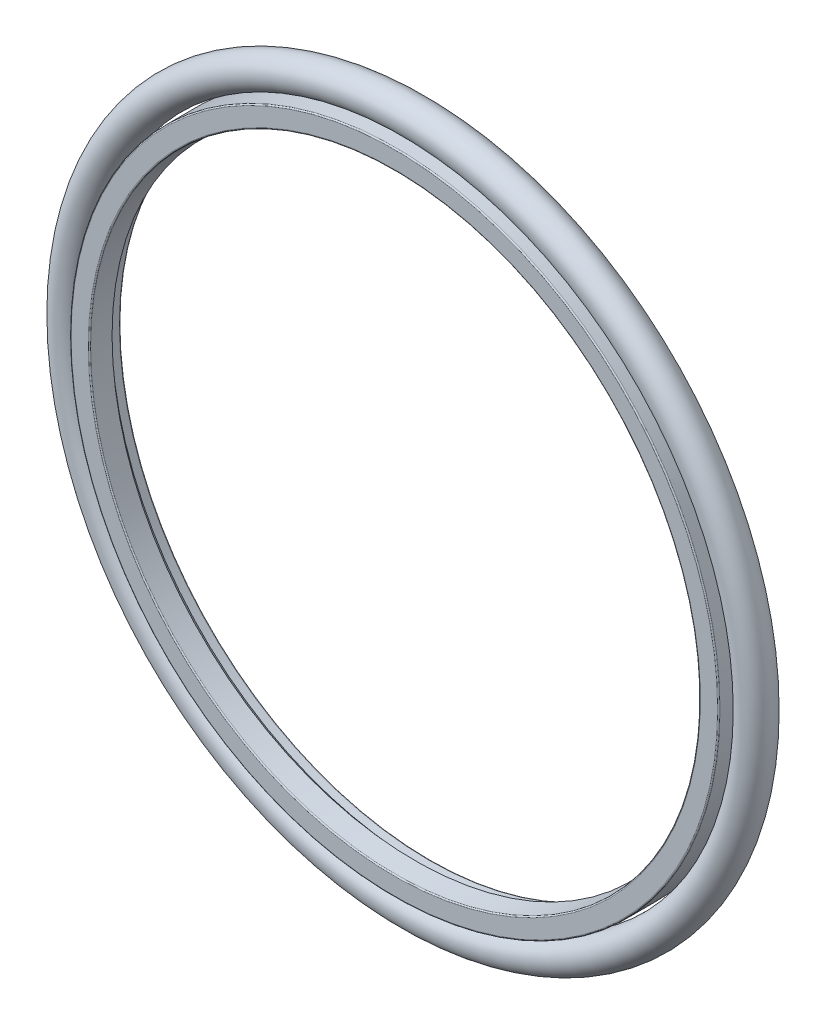
from build123d import *

# Parameters (mm, degrees)
SKETCH4_R = 2.665


with BuildPart() as part:
    # Sketch1 → Revolve1 (revolve)
    with BuildSketch(Plane(origin=(0, 0, 0), x_dir=(0, 0, -1), z_dir=(1, 0, 0))):
        with BuildLine():
            Line((0, 51.05), (0, 53.05))
            ThreePointArc((0, 53.05), (-0.058578644, 53.191421356), (-0.2, 53.25))
            Line((-0.2, 53.25), (-5.72, 53.25))
            ThreePointArc((-5.72, 53.25), (-5.861421356, 53.191421356), (-5.92, 53.05))
            Line((-5.92, 53.05), (-5.92, 50.233224133))
            ThreePointArc((-5.92, 50.233224133), (-5.867470929, 50.098122967), (-5.73747675, 50.033989189))
            Line((-5.73747675, 50.033989189), (-2.5, 49.75))
            Line((-2.5, 49.75), (-1.5, 50.85))
            Line((-1.5, 50.85), (-0.2, 50.85))
            ThreePointArc((-0.2, 50.85), (-0.058578644, 50.908578644), (0, 51.05))
        make_face()
    revolve(axis=Axis((0, 0, 0), (0, 0, 1)))


with BuildPart() as body_2:
    # Sketch4 → Revolve2 (revolve)
    with BuildSketch(Plane(origin=(0, 0, 0), x_dir=(0, 0, -1), z_dir=(1, 0, 0))):
        with Locations((-2.86, 56.325)):
            Circle(SKETCH4_R)
    revolve(axis=Axis((0, 0, 0), (0, 0, 1)))


solid = Compound([part.part, body_2.part])
